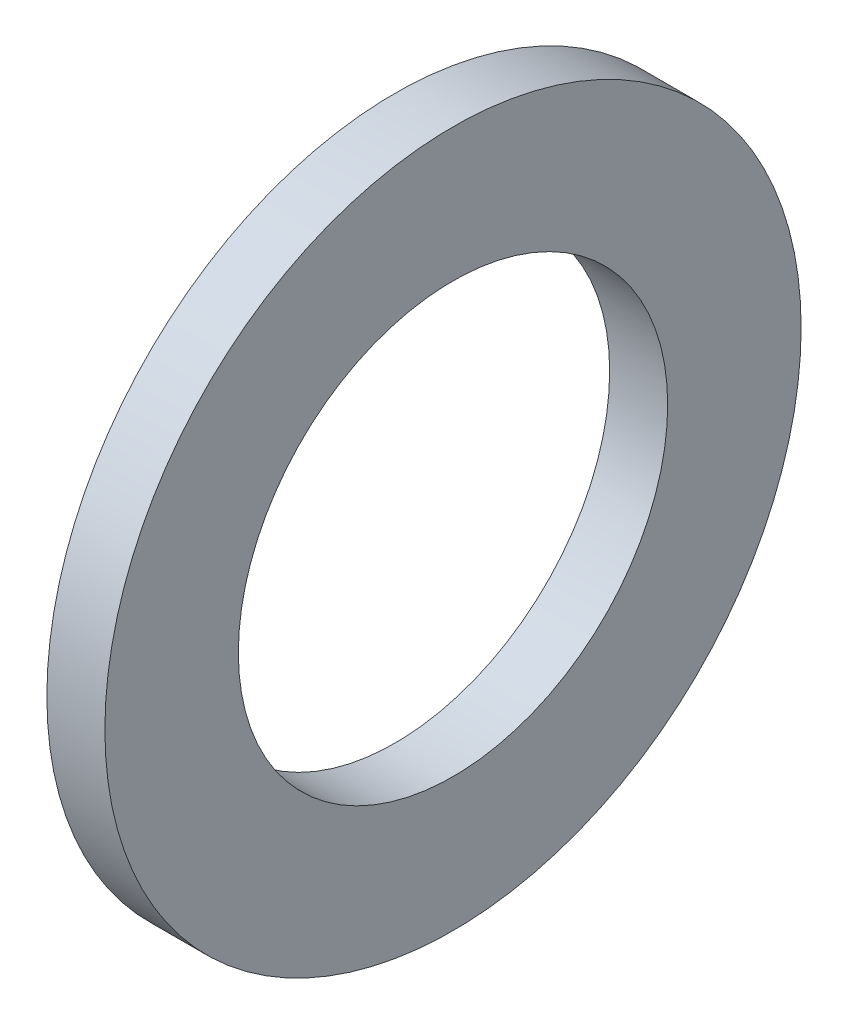
from build123d import *

# Parameters (mm, degrees)
SKETCH1_W = 5
SKETCH1_H = 11.5


with BuildPart() as part:
    # Sketch1 → Base-Revolve (revolve)
    with BuildSketch(Plane.XY):
        with Locations((-2.5, 24.25)):
            Rectangle(SKETCH1_W, SKETCH1_H)
    revolve(axis=Axis((-34.925, 0, 0), (1, 0, 0)))


solid = part.part
